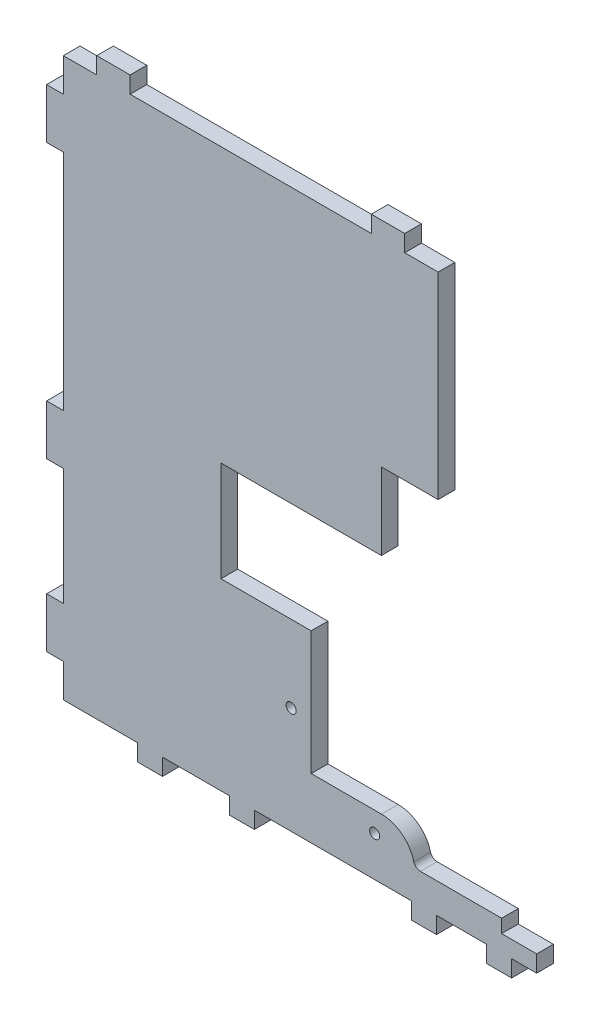
from build123d import *

# Parameters (mm, degrees)
ESQUISSE1_R        = 1.5
BOSS_EXTRU_1_DEPTH = 5
BOSS_EXTRU_2_DEPTH = 5
CONG_1_R           = 10
CONG_2_R           = 2


with BuildPart() as part:
    # Esquisse1 → Boss.-Extru.1 (new body)
    with BuildSketch(Plane.XY):
        Polygon((0, 0), (37, 0), (37, 18), (12, 18), (12, 55), (0, 55), align=None)
        with Locations((6, 32)):
            Circle(ESQUISSE1_R, mode=Mode.SUBTRACT)
        with Locations((31, 12)):
            Circle(ESQUISSE1_R, mode=Mode.SUBTRACT)
    extrude(amount=BOSS_EXTRU_1_DEPTH)

    # Esquisse2 → Boss.-Extru.2 (add)
    with BuildSketch(Plane.XY.offset(5)):
        Polygon((37, 0), (42, 0), (42, -5), (49.5, -5), (49.5, 0), (64.5, 0), (64.5, -5), (72, -5), (72, 0), (79.5, 0), (79.5, 5), (69, 5), (69, 9), (43, 9), (43, 18), (37, 18), align=None)
        Polygon((0, 0), (-5, 0), (-5, -5), (-12.5, -5), (-12.5, 0), (-32.5, 0), (-32.5, -5), (-40, -5), (-40, 0), (-62.19, 0), (-62.19, 10), (-67.19, 10), (-67.19, 25), (-62.19, 25), (-62.19, 60), (-67.19, 60), (-67.19, 75), (-62.19, 75), (-62.19, 142), (-67.19, 142), (-67.19, 157), (-62.19, 157), (-62.19, 167), (-52.19, 167), (-52.19, 172), (-42.19, 172), (-42.19, 167), (30, 167), (30, 172), (40, 172), (40, 167), (50, 167), (50, 108), (33, 108), (33, 85), (-15, 85), (-15, 55), (0, 55), align=None)
    extrude(amount=-BOSS_EXTRU_2_DEPTH)

    # Congé1
    # the kernel refuses this fillet: 10 mm, written as the material it takes off along each edge
    with BuildSketch(Plane(origin=(43, 18, 29.874685928), x_dir=(0, -1, 0), z_dir=(0, 0, -1))) as cong_1_piece_1:
        with BuildLine():
            CenterArc((10, 9.949874371), CONG_1_R, 180, 84.260829523)
            Line((0, 9.949874371), (-0.2, 9.949874371))
            Line((-0.2, 9.949874371), (-0.2, 0))
            Line((-0.2, 0), (0, -0.2))
            ThreePointArc((0, -0.2), (4.5, -0.2), (8.98, -0.198997487))
            Line((8.98, -0.198997487), (9, 0))
        make_face()
    extrude(amount=54.749371855, mode=Mode.SUBTRACT)

    # Congé2
    cong_2_edges = [part.edges().sort_by_distance(p)[0] for p in [
        (43, 9, 2.5),
    ]]
    fillet(cong_2_edges, radius=CONG_2_R)


solid = part.part
